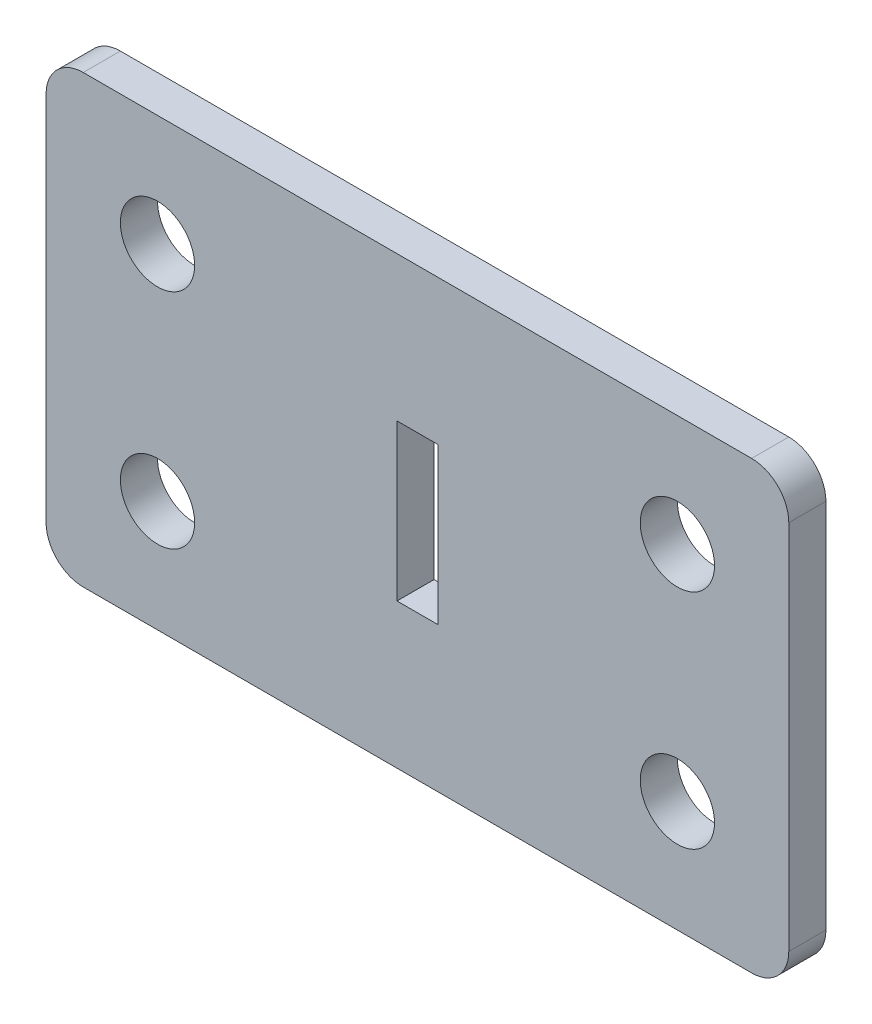
from build123d import *

# Parameters (mm, degrees)
IZIM1_W               = 100
IZIM1_H               = 60
TABAN_FLAN_1_DEPTH    = 5
RADYUS1_R             = 5
IZIM6_R               = 5
KES_EKSTR_ZYON1_DEPTH = 10
IZIM7_W               = 5.5
IZIM7_H               = 21
KES_EKSTR_ZYON2_DEPTH = 10


# Sheet-metal steps are written as plain solids
with BuildPart() as part:
    # Çizim1 → Taban-Flanş1 (new body)
    with BuildSketch(Plane.XY):
        Rectangle(IZIM1_W, IZIM1_H)
    extrude(amount=-TABAN_FLAN_1_DEPTH)

    # Radyus1
    radyus1_edges = [part.edges().sort_by_distance(p)[0] for p in [
        (50, -30, -2.5),
        (-50, -30, -2.5),
        (-50, 30, -2.5),
        (50, 30, -2.5),
    ]]
    fillet(radyus1_edges, radius=RADYUS1_R)

    # Çizim6 → Kes-Ekstrüzyon1 (cut)
    with BuildSketch(Plane.XY):
        with Locations((-35, 15)):
            Circle(IZIM6_R)
        with Locations((-35, -15)):
            Circle(IZIM6_R)
        with Locations((35, 15)):
            Circle(IZIM6_R)
        with Locations((35, -15)):
            Circle(IZIM6_R)
    extrude(amount=-KES_EKSTR_ZYON1_DEPTH, mode=Mode.SUBTRACT)

    # Çizim7 → Kes-Ekstrüzyon2 (cut)
    with BuildSketch(Plane(origin=(0, 0, -5), x_dir=(-1, 0, 0), z_dir=(0, 0, -1))):
        Rectangle(IZIM7_W, IZIM7_H)
    extrude(amount=-KES_EKSTR_ZYON2_DEPTH, mode=Mode.SUBTRACT)


solid = part.part
